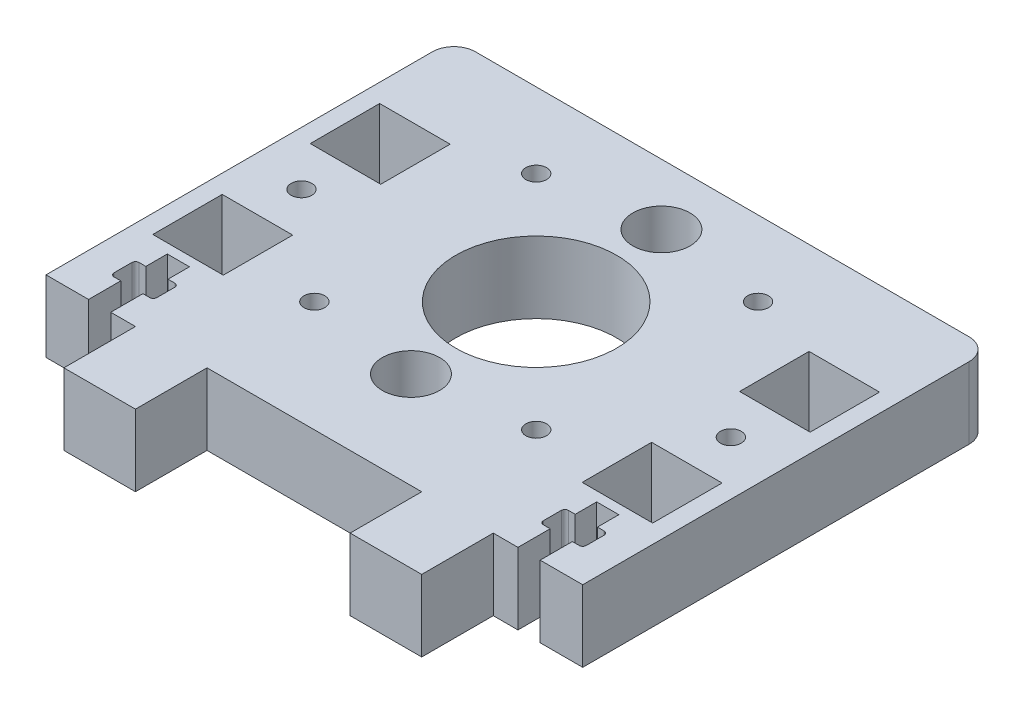
from build123d import *

# Parameters (mm, degrees)
SKETCH1_R          = 1.45
SKETCH1_W          = 9.85
SKETCH1_H          = 9.7
MAINLAYOUT_DEPTH   = 10
TSLOT_DEPTH        = 53.936282454
SKETCH3_R          = 4
CUT_EXTRUDE1_DEPTH = 53.936282454


with BuildPart() as part:
    # Sketch1 → MainLayout (new body)
    with BuildSketch(Plane(origin=(0, 0, 0), x_dir=(1, 0, 0), z_dir=(0, 1, 0))):
        with BuildLine():
            Line((-34.5, 31), (0, 31))
            Line((0, 31), (0, 16.25))
            ThreePointArc((0, 16.25), (-11.25, 5), (0, -6.25))
            Line((0, -6.25), (0, -8.5))
            ThreePointArc((0, -8.5), (-4, -12.5), (0, -16.5))
            Line((0, -16.5), (0, -26))
            Line((0, -26), (-15, -26))
            Line((-15, -26), (-15, -36))
            Line((-15, -36), (-25, -36))
            Line((-25, -36), (-25, -26))
            Line((-25, -26), (-37.5, -26))
            Line((-37.5, -26), (-37.5, 28))
            ThreePointArc((-37.5, 28), (-36.621320344, 30.121320344), (-34.5, 31))
        make_face()
        with Locations((-15.5, 20.5)):
            Circle(SKETCH1_R, mode=Mode.SUBTRACT)
        with Locations((-15.5, -10.5)):
            Circle(SKETCH1_R, mode=Mode.SUBTRACT)
        with Locations((-30, 2.2)):
            Circle(SKETCH1_R, mode=Mode.SUBTRACT)
        with Locations((-30, 13.2)):
            Rectangle(SKETCH1_W, SKETCH1_H, mode=Mode.SUBTRACT)
        with Locations((-30, -8.8)):
            Rectangle(SKETCH1_W, SKETCH1_H, mode=Mode.SUBTRACT)
    mainlayout = extrude(amount=MAINLAYOUT_DEPTH)

    # Sketch2 → TSlot (cut, through all)
    with BuildSketch(Plane(origin=(0, 10, 0), x_dir=(1, 0, 0), z_dir=(0, 1, 0))):
        with BuildLine():
            Line((-28.45, -21.5), (-28.45, -26))
            Line((-28.45, -26), (-31.55, -26))
            Line((-31.55, -26), (-31.55, -21.5))
            Line((-31.55, -21.5), (-32.5, -21.5))
            ThreePointArc((-32.5, -21.5), (-32.853553391, -21.353553391), (-33, -21))
            Line((-33, -21), (-33, -18.5))
            ThreePointArc((-33, -18.5), (-32.853553391, -18.146446609), (-32.5, -18))
            Line((-32.5, -18), (-31.55, -18))
            Line((-31.55, -18), (-31.55, -15))
            Line((-31.55, -15), (-28.45, -15))
            Line((-28.45, -15), (-28.45, -18))
            Line((-28.45, -18), (-27.5, -18))
            ThreePointArc((-27.5, -18), (-27.146446609, -18.146446609), (-27, -18.5))
            Line((-27, -18.5), (-27, -21))
            ThreePointArc((-27, -21), (-27.146446609, -21.353553391), (-27.5, -21.5))
            Line((-27.5, -21.5), (-28.45, -21.5))
        make_face()
    tslot = extrude(amount=-TSLOT_DEPTH, mode=Mode.SUBTRACT)

    # Mirror1: MainLayout, TSlot across plane
    add(mainlayout.mirror(Plane(origin=(0, 0, 0), x_dir=(0, 0, 1), z_dir=(1, 0, 0))))
    add(tslot.mirror(Plane(origin=(0, 0, 0), x_dir=(0, 0, 1), z_dir=(1, 0, 0))), mode=Mode.SUBTRACT)

    # Sketch3 → Cut-Extrude1 (cut, through all)
    with BuildSketch(Plane(origin=(0, 10, 0), x_dir=(1, 0, 0), z_dir=(0, 1, 0))):
        with Locations((0, 22.5)):
            Circle(SKETCH3_R)
    extrude(amount=-CUT_EXTRUDE1_DEPTH, mode=Mode.SUBTRACT)


solid = part.part
